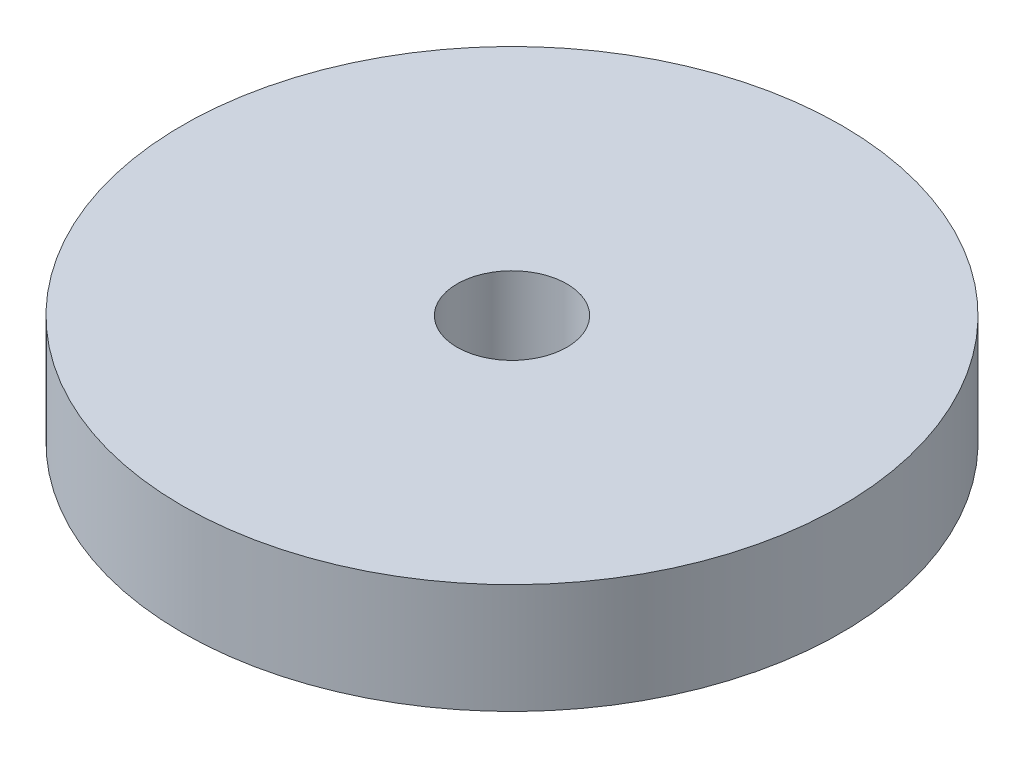
from build123d import *

# Parameters (mm, degrees)
SKETCH1_R           = 15
SKETCH1_R_2         = 2.5
BOSS_EXTRUDE1_DEPTH = 5


with BuildPart() as part:
    # Sketch1 → Boss-Extrude1 (new body)
    with BuildSketch(Plane(origin=(0, 0, 0), x_dir=(1, 0, 0), z_dir=(0, 1, 0))):
        Circle(SKETCH1_R)
        Circle(SKETCH1_R_2, mode=Mode.SUBTRACT)
    extrude(amount=BOSS_EXTRUDE1_DEPTH)


solid = part.part
